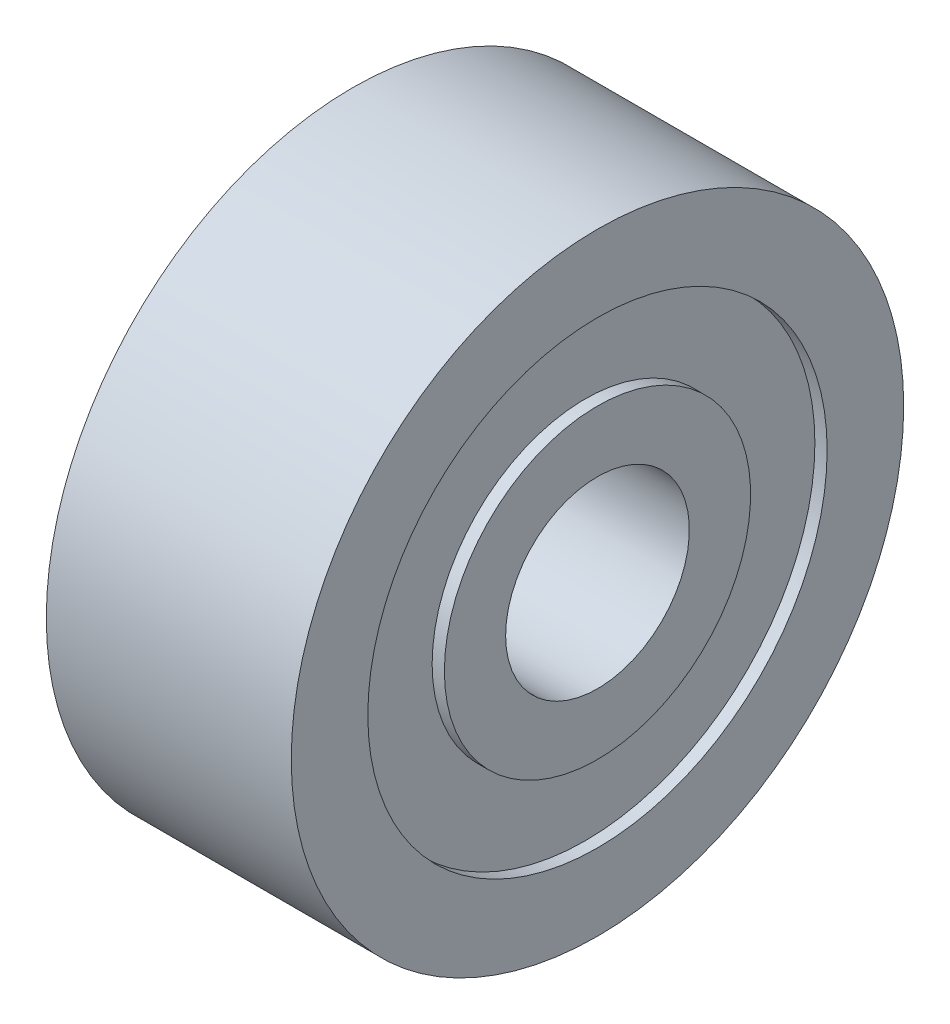
from build123d import *


with BuildPart() as part:
    # Esquisse1 → Révolution1 (revolve)
    with BuildSketch(Plane.XY):
        Polygon((-2, 2.5), (-1.8, 2.5), (-1.8, 3.75), (-2, 3.75), (-2, 5), (2, 5), (2, 3.75), (1.8, 3.75), (1.8, 2.5), (2, 2.5), (2, 1.5), (-2, 1.5), align=None)
    revolve(axis=Axis((-2, 0, 0), (1, 0, 0)))


solid = part.part
